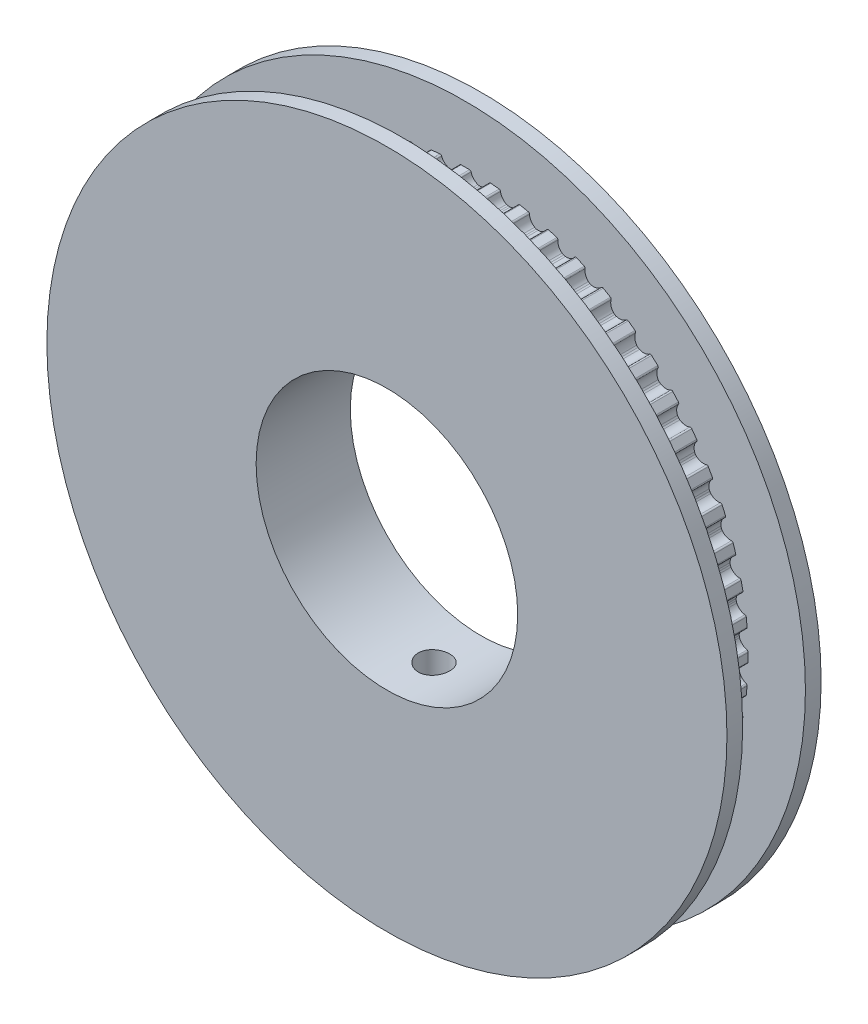
from build123d import *

# Parameters (mm, degrees)
SKETCH2_R           = 27.692960098
BOSS_EXTRUDE1_DEPTH = 3
SKETCH3_R           = 27.692960098
CUT_EXTRUDE5_DEPTH  = 40.620702644
SKETCH4_R           = 32.5
BOSS_EXTRUDE2_DEPTH = 1.5
BOSS_EXTRUDE3_START = 1.5
SKETCH5_R           = 32.5
BOSS_EXTRUDE3_DEPTH = 1.5
CUT_EXTRUDE6_REACH  = 48.835
SKETCH6_R           = 12.5
SKETCH8_R           = 1.5
CUT_EXTRUDE7_DEPTH  = 47.181706335


with BuildPart() as part:
    # Sketch2 → Boss-Extrude1 (new, symmetric)
    with BuildSketch(Plane.XY):
        Circle(SKETCH2_R)
    extrude(amount=BOSS_EXTRUDE1_DEPTH, both=True)

    # Sketch3 → Cut-Extrude5 (cut, through all)
    with BuildSketch(Plane.XY.offset(3)):
        Circle(SKETCH3_R)
        with BuildLine():
            Line((2.427877919, 26.926424266), (3.223495435, 26.842801495))
            ThreePointArc((3.223495435, 26.842801495), (3.312543817, 26.801010915), (3.356554343, 26.713038531))
            ThreePointArc((3.356554343, 26.713038531), (3.543312083, 26.248968735), (3.931469889, 25.933417238))
            ThreePointArc((3.931469889, 25.933417238), (4.013941141, 25.903512456), (4.100094244, 25.886976241))
            ThreePointArc((4.100094244, 25.886976241), (4.187140685, 25.876080343), (4.274816593, 25.879036463))
            ThreePointArc((4.274816593, 25.879036463), (4.741487378, 26.059196411), (5.062509997, 26.442841699))
            ThreePointArc((5.062509997, 26.442841699), (5.131551457, 26.512908409), (5.2291555, 26.525136148))
            Line((5.2291555, 26.525136148), (6.01167358, 26.358806796))
            ThreePointArc((6.01167358, 26.358806796), (6.09586584, 26.307937059), (6.130439654, 26.215846244))
            ThreePointArc((6.130439654, 26.215846244), (6.267665813, 25.734797171), (6.620713136, 25.380400759))
            ThreePointArc((6.620713136, 25.380400759), (6.699606702, 25.342039205), (6.783559343, 25.316588126))
            ThreePointArc((6.783559343, 25.316588126), (6.868990004, 25.296653086), (6.956494612, 25.290428384))
            ThreePointArc((6.956494612, 25.290428384), (7.439440769, 25.420821017), (7.798806645, 25.768808656))
            ThreePointArc((7.798806645, 25.768808656), (7.874793854, 25.831274734), (7.973141358, 25.833233089))
            Line((7.973141358, 25.833233089), (8.733986571, 25.586019493))
            ThreePointArc((8.733986571, 25.586019493), (8.812400282, 25.526627938), (8.837158585, 25.431427659))
            ThreePointArc((8.837158585, 25.431427659), (8.923349684, 24.938669783), (9.237418465, 24.549311298))
            ThreePointArc((9.237418465, 24.549311298), (9.311869969, 24.50291327), (9.392702348, 24.468826174))
            ThreePointArc((9.392702348, 24.468826174), (9.47558123, 24.440070404), (9.561955821, 24.424733079))
            ThreePointArc((9.561955821, 24.424733079), (10.05588609, 24.503929789), (10.449657935, 24.812447152))
            ThreePointArc((10.449657935, 24.812447152), (10.531758361, 24.866628208), (10.629771812, 24.858295721))
            Line((10.629771812, 24.858295721), (11.360608178, 24.532906407))
            ThreePointArc((11.360608178, 24.532906407), (11.432384222, 24.46564374), (11.447055758, 24.36837703))
            ThreePointArc((11.447055758, 24.36837703), (11.48126747, 23.869309111), (11.752916705, 23.449254446))
            ThreePointArc((11.752916705, 23.449254446), (11.822110441, 23.395328289), (11.898936939, 23.352978641))
            ThreePointArc((11.898936939, 23.352978641), (11.978356007, 23.315717197), (12.062654241, 23.291435288))
            ThreePointArc((12.062654241, 23.291435288), (12.562157019, 23.318568378), (12.986020586, 23.584235284))
            ThreePointArc((12.986020586, 23.584235284), (13.07333472, 23.6295377), (13.169940261, 23.611005664))
            Line((13.169940261, 23.611005664), (13.862760584, 23.211005664))
            ThreePointArc((13.862760584, 23.211005664), (13.927112568, 23.13660883), (13.931536592, 23.038341364))
            ThreePointArc((13.931536592, 23.038341364), (13.913394086, 22.538431294), (14.139647529, 22.092282654))
            ThreePointArc((14.139647529, 22.092282654), (14.202825397, 22.031419196), (14.274804288, 21.981270988))
            ThreePointArc((14.274804288, 21.981270988), (14.349893408, 21.935912113), (14.431191697, 21.902951658))
            ThreePointArc((14.431191697, 21.902951658), (14.930794326, 21.877723852), (15.380105678, 22.0976296))
            ThreePointArc((15.380105678, 22.0976296), (15.471676888, 22.133557032), (15.565816088, 22.105028488))
            Line((15.565816088, 22.105028488), (16.213029684, 21.634800286))
            ThreePointArc((16.213029684, 21.634800286), (16.269252554, 21.554084391), (16.263380596, 21.455892809))
            ThreePointArc((16.263380596, 21.455892809), (16.193082645, 20.960617706), (16.371461417, 20.493263191))
            ThreePointArc((16.371461417, 20.493263191), (16.427931225, 20.426129263), (16.494273893, 20.36873193))
            ThreePointArc((16.494273893, 20.36873193), (16.564210374, 20.315772585), (16.641617997, 20.274494706))
            ThreePointArc((16.641617997, 20.274494706), (17.135846727, 20.197182405), (17.605683114, 20.368917661))
            ThreePointArc((17.605683114, 20.368917661), (17.700508127, 20.395076482), (17.791149577, 20.356863994))
            Line((17.791149577, 20.356863994), (18.385665438, 19.821559509))
            ThreePointArc((18.385665438, 19.821559509), (18.433143205, 19.735408894), (18.417039599, 19.638369002))
            ThreePointArc((18.417039599, 19.638369002), (18.295356402, 19.153155205), (18.423906147, 18.669715248))
            ThreePointArc((18.423906147, 18.669715248), (18.473049201, 18.597046384), (18.533028782, 18.533028782))
            ThreePointArc((18.533028782, 18.533028782), (18.597046384, 18.473049201), (18.669715248, 18.423906147))
            ThreePointArc((18.669715248, 18.423906147), (19.153155205, 18.295356402), (19.638369002, 18.417039599))
            ThreePointArc((19.638369002, 18.417039599), (19.735408894, 18.433143205), (19.821559509, 18.385665438))
            Line((19.821559509, 18.385665438), (20.356863994, 17.791149577))
            ThreePointArc((20.356863994, 17.791149577), (20.395076482, 17.700508127), (20.368917661, 17.605683114))
            ThreePointArc((20.368917661, 17.605683114), (20.197182405, 17.135846727), (20.274494706, 16.641617997))
            ThreePointArc((20.274494706, 16.641617997), (20.315772585, 16.564210374), (20.36873193, 16.494273893))
            ThreePointArc((20.36873193, 16.494273893), (20.426129263, 16.427931225), (20.493263191, 16.371461417))
            ThreePointArc((20.493263191, 16.371461417), (20.960617706, 16.193082645), (21.455892809, 16.263380596))
            ThreePointArc((21.455892809, 16.263380596), (21.554084391, 16.269252554), (21.634800286, 16.213029684))
            Line((21.634800286, 16.213029684), (22.105028488, 15.565816088))
            ThreePointArc((22.105028488, 15.565816088), (22.133557032, 15.471676888), (22.0976296, 15.380105678))
            ThreePointArc((22.0976296, 15.380105678), (21.877723852, 14.930794326), (21.902951658, 14.431191697))
            ThreePointArc((21.902951658, 14.431191697), (21.935912113, 14.349893408), (21.981270988, 14.274804288))
            ThreePointArc((21.981270988, 14.274804288), (22.031419196, 14.202825397), (22.092282654, 14.139647529))
            ThreePointArc((22.092282654, 14.139647529), (22.538431294, 13.913394086), (23.038341364, 13.931536592))
            ThreePointArc((23.038341364, 13.931536592), (23.13660883, 13.927112568), (23.211005664, 13.862760584))
            Line((23.211005664, 13.862760584), (23.611005664, 13.169940261))
            ThreePointArc((23.611005664, 13.169940261), (23.6295377, 13.07333472), (23.584235284, 12.986020586))
            ThreePointArc((23.584235284, 12.986020586), (23.318568378, 12.562157019), (23.291435288, 12.062654241))
            ThreePointArc((23.291435288, 12.062654241), (23.315717197, 11.978356007), (23.352978641, 11.898936939))
            ThreePointArc((23.352978641, 11.898936939), (23.395328289, 11.822110441), (23.449254446, 11.752916705))
            ThreePointArc((23.449254446, 11.752916705), (23.869309111, 11.48126747), (24.36837703, 11.447055758))
            ThreePointArc((24.36837703, 11.447055758), (24.46564374, 11.432384222), (24.532906407, 11.360608178))
            Line((24.532906407, 11.360608178), (24.858295721, 10.629771812))
            ThreePointArc((24.858295721, 10.629771812), (24.866628208, 10.531758361), (24.812447152, 10.449657935))
            ThreePointArc((24.812447152, 10.449657935), (24.503929789, 10.05588609), (24.424733079, 9.561955821))
            ThreePointArc((24.424733079, 9.561955821), (24.440070404, 9.47558123), (24.468826174, 9.392702348))
            ThreePointArc((24.468826174, 9.392702348), (24.50291327, 9.311869969), (24.549311298, 9.237418465))
            ThreePointArc((24.549311298, 9.237418465), (24.938669783, 8.923349684), (25.431427659, 8.837158585))
            ThreePointArc((25.431427659, 8.837158585), (25.526627938, 8.812400282), (25.586019493, 8.733986571))
            Line((25.586019493, 8.733986571), (25.833233089, 7.973141358))
            ThreePointArc((25.833233089, 7.973141358), (25.831274734, 7.874793854), (25.768808656, 7.798806645))
            ThreePointArc((25.768808656, 7.798806645), (25.420821017, 7.439440769), (25.290428384, 6.956494612))
            ThreePointArc((25.290428384, 6.956494612), (25.296653086, 6.868990004), (25.316588126, 6.783559343))
            ThreePointArc((25.316588126, 6.783559343), (25.342039205, 6.699606702), (25.380400759, 6.620713136))
            ThreePointArc((25.380400759, 6.620713136), (25.734797171, 6.267665813), (26.215846244, 6.130439654))
            ThreePointArc((26.215846244, 6.130439654), (26.307937059, 6.09586584), (26.358806796, 6.01167358))
            Line((26.358806796, 6.01167358), (26.525136148, 5.2291555))
            ThreePointArc((26.525136148, 5.2291555), (26.512908409, 5.131551457), (26.442841699, 5.062509997))
            ThreePointArc((26.442841699, 5.062509997), (26.059196411, 4.741487378), (25.879036463, 4.274816593))
            ThreePointArc((25.879036463, 4.274816593), (25.876080343, 4.187140685), (25.886976241, 4.100094244))
            ThreePointArc((25.886976241, 4.100094244), (25.903512456, 4.013941141), (25.933417238, 3.931469889))
            ThreePointArc((25.933417238, 3.931469889), (26.248968735, 3.543312083), (26.713038531, 3.356554343))
            ThreePointArc((26.713038531, 3.356554343), (26.801010915, 3.312543817), (26.842801495, 3.223495435))
            Line((26.842801495, 3.223495435), (26.926424266, 2.427877919))
            ThreePointArc((26.926424266, 2.427877919), (26.90406111, 2.332086708), (26.827161436, 2.27074743))
            ThreePointArc((26.827161436, 2.27074743), (26.412061796, 1.991585259), (26.184108402, 1.546302788))
            ThreePointArc((26.184108402, 1.546302788), (26.172003849, 1.459416176), (26.173741227, 1.371707653))
            ThreePointArc((26.173741227, 1.371707653), (26.181181403, 1.284298001), (26.202301771, 1.199152634))
            ThreePointArc((26.202301771, 1.199152634), (26.475551105, 0.780137084), (26.917557178, 0.54589392))
            ThreePointArc((26.917557178, 0.54589392), (27.000447288, 0.49292887), (27.032700844, 0.4))
            Line((27.032700844, 0.4), (27.032700844, -0.4))
            ThreePointArc((27.032700844, -0.4), (27.000447288, -0.49292887), (26.917557178, -0.54589392))
            ThreePointArc((26.917557178, -0.54589392), (26.475551105, -0.780137084), (26.202301771, -1.199152634))
            ThreePointArc((26.202301771, -1.199152634), (26.181181403, -1.284298001), (26.173741227, -1.371707653))
            ThreePointArc((26.173741227, -1.371707653), (26.172003849, -1.459416176), (26.184108402, -1.546302788))
            ThreePointArc((26.184108402, -1.546302788), (26.412061796, -1.991585259), (26.827161436, -2.27074743))
            ThreePointArc((26.827161436, -2.27074743), (26.90406111, -2.332086708), (26.926424266, -2.427877919))
            Line((26.926424266, -2.427877919), (26.842801495, -3.223495435))
            ThreePointArc((26.842801495, -3.223495435), (26.801010915, -3.312543817), (26.713038531, -3.356554343))
            ThreePointArc((26.713038531, -3.356554343), (26.248968735, -3.543312083), (25.933417238, -3.931469889))
            ThreePointArc((25.933417238, -3.931469889), (25.903512456, -4.013941141), (25.886976241, -4.100094244))
            ThreePointArc((25.886976241, -4.100094244), (25.876080343, -4.187140685), (25.879036463, -4.274816593))
            ThreePointArc((25.879036463, -4.274816593), (26.059196411, -4.741487378), (26.442841699, -5.062509997))
            ThreePointArc((26.442841699, -5.062509997), (26.512908409, -5.131551457), (26.525136148, -5.2291555))
            Line((26.525136148, -5.2291555), (26.358806796, -6.01167358))
            ThreePointArc((26.358806796, -6.01167358), (26.307937059, -6.09586584), (26.215846244, -6.130439654))
            ThreePointArc((26.215846244, -6.130439654), (25.734797171, -6.267665813), (25.380400759, -6.620713136))
            ThreePointArc((25.380400759, -6.620713136), (25.342039205, -6.699606702), (25.316588126, -6.783559343))
            ThreePointArc((25.316588126, -6.783559343), (25.296653086, -6.868990004), (25.290428384, -6.956494612))
            ThreePointArc((25.290428384, -6.956494612), (25.420821017, -7.439440769), (25.768808656, -7.798806645))
            ThreePointArc((25.768808656, -7.798806645), (25.831274734, -7.874793854), (25.833233089, -7.973141358))
            Line((25.833233089, -7.973141358), (25.586019493, -8.733986571))
            ThreePointArc((25.586019493, -8.733986571), (25.526627938, -8.812400282), (25.431427659, -8.837158585))
            ThreePointArc((25.431427659, -8.837158585), (24.938669783, -8.923349684), (24.549311298, -9.237418465))
            ThreePointArc((24.549311298, -9.237418465), (24.50291327, -9.311869969), (24.468826174, -9.392702348))
            ThreePointArc((24.468826174, -9.392702348), (24.440070404, -9.47558123), (24.424733079, -9.561955821))
            ThreePointArc((24.424733079, -9.561955821), (24.503929789, -10.05588609), (24.812447152, -10.449657935))
            ThreePointArc((24.812447152, -10.449657935), (24.866628208, -10.531758361), (24.858295721, -10.629771812))
            Line((24.858295721, -10.629771812), (24.532906407, -11.360608178))
            ThreePointArc((24.532906407, -11.360608178), (24.46564374, -11.432384222), (24.36837703, -11.447055758))
            ThreePointArc((24.36837703, -11.447055758), (23.869309111, -11.48126747), (23.449254446, -11.752916705))
            ThreePointArc((23.449254446, -11.752916705), (23.395328289, -11.822110441), (23.352978641, -11.898936939))
            ThreePointArc((23.352978641, -11.898936939), (23.315717197, -11.978356007), (23.291435288, -12.062654241))
            ThreePointArc((23.291435288, -12.062654241), (23.318568378, -12.562157019), (23.584235284, -12.986020586))
            ThreePointArc((23.584235284, -12.986020586), (23.6295377, -13.07333472), (23.611005664, -13.169940261))
            Line((23.611005664, -13.169940261), (23.211005664, -13.862760584))
            ThreePointArc((23.211005664, -13.862760584), (23.13660883, -13.927112568), (23.038341364, -13.931536592))
            ThreePointArc((23.038341364, -13.931536592), (22.538431294, -13.913394086), (22.092282654, -14.139647529))
            ThreePointArc((22.092282654, -14.139647529), (22.031419196, -14.202825397), (21.981270988, -14.274804288))
            ThreePointArc((21.981270988, -14.274804288), (21.935912113, -14.349893408), (21.902951658, -14.431191697))
            ThreePointArc((21.902951658, -14.431191697), (21.877723852, -14.930794326), (22.0976296, -15.380105678))
            ThreePointArc((22.0976296, -15.380105678), (22.133557032, -15.471676888), (22.105028488, -15.565816088))
            Line((22.105028488, -15.565816088), (21.634800286, -16.213029684))
            ThreePointArc((21.634800286, -16.213029684), (21.554084391, -16.269252554), (21.455892809, -16.263380596))
            ThreePointArc((21.455892809, -16.263380596), (20.960617706, -16.193082645), (20.493263191, -16.371461417))
            ThreePointArc((20.493263191, -16.371461417), (20.426129263, -16.427931225), (20.36873193, -16.494273893))
            ThreePointArc((20.36873193, -16.494273893), (20.315772585, -16.564210374), (20.274494706, -16.641617997))
            ThreePointArc((20.274494706, -16.641617997), (20.197182405, -17.135846727), (20.368917661, -17.605683114))
            ThreePointArc((20.368917661, -17.605683114), (20.395076482, -17.700508127), (20.356863994, -17.791149577))
            Line((20.356863994, -17.791149577), (19.821559509, -18.385665438))
            ThreePointArc((19.821559509, -18.385665438), (19.735408894, -18.433143205), (19.638369002, -18.417039599))
            ThreePointArc((19.638369002, -18.417039599), (19.153155205, -18.295356402), (18.669715248, -18.423906147))
            ThreePointArc((18.669715248, -18.423906147), (18.597046384, -18.473049201), (18.533028782, -18.533028782))
            ThreePointArc((18.533028782, -18.533028782), (18.473049201, -18.597046384), (18.423906147, -18.669715248))
            ThreePointArc((18.423906147, -18.669715248), (18.295356402, -19.153155205), (18.417039599, -19.638369002))
            ThreePointArc((18.417039599, -19.638369002), (18.433143205, -19.735408894), (18.385665438, -19.821559509))
            Line((18.385665438, -19.821559509), (17.791149577, -20.356863994))
            ThreePointArc((17.791149577, -20.356863994), (17.700508127, -20.395076482), (17.605683114, -20.368917661))
            ThreePointArc((17.605683114, -20.368917661), (17.135846727, -20.197182405), (16.641617997, -20.274494706))
            ThreePointArc((16.641617997, -20.274494706), (16.564210374, -20.315772585), (16.494273893, -20.36873193))
            ThreePointArc((16.494273893, -20.36873193), (16.427931225, -20.426129263), (16.371461417, -20.493263191))
            ThreePointArc((16.371461417, -20.493263191), (16.193082645, -20.960617706), (16.263380596, -21.455892809))
            ThreePointArc((16.263380596, -21.455892809), (16.269252554, -21.554084391), (16.213029684, -21.634800286))
            Line((16.213029684, -21.634800286), (15.565816088, -22.105028488))
            ThreePointArc((15.565816088, -22.105028488), (15.471676888, -22.133557032), (15.380105678, -22.0976296))
            ThreePointArc((15.380105678, -22.0976296), (14.930794326, -21.877723852), (14.431191697, -21.902951658))
            ThreePointArc((14.431191697, -21.902951658), (14.349893408, -21.935912113), (14.274804288, -21.981270988))
            ThreePointArc((14.274804288, -21.981270988), (14.202825397, -22.031419196), (14.139647529, -22.092282654))
            ThreePointArc((14.139647529, -22.092282654), (13.913394086, -22.538431294), (13.931536592, -23.038341364))
            ThreePointArc((13.931536592, -23.038341364), (13.927112568, -23.13660883), (13.862760584, -23.211005664))
            Line((13.862760584, -23.211005664), (13.169940261, -23.611005664))
            ThreePointArc((13.169940261, -23.611005664), (13.07333472, -23.6295377), (12.986020586, -23.584235284))
            ThreePointArc((12.986020586, -23.584235284), (12.562157019, -23.318568378), (12.062654241, -23.291435288))
            ThreePointArc((12.062654241, -23.291435288), (11.978356007, -23.315717197), (11.898936939, -23.352978641))
            ThreePointArc((11.898936939, -23.352978641), (11.822110441, -23.395328289), (11.752916705, -23.449254446))
            ThreePointArc((11.752916705, -23.449254446), (11.48126747, -23.869309111), (11.447055758, -24.36837703))
            ThreePointArc((11.447055758, -24.36837703), (11.432384222, -24.46564374), (11.360608178, -24.532906407))
            Line((11.360608178, -24.532906407), (10.629771812, -24.858295721))
            ThreePointArc((10.629771812, -24.858295721), (10.531758361, -24.866628208), (10.449657935, -24.812447152))
            ThreePointArc((10.449657935, -24.812447152), (10.05588609, -24.503929789), (9.561955821, -24.424733079))
            ThreePointArc((9.561955821, -24.424733079), (9.47558123, -24.440070404), (9.392702348, -24.468826174))
            ThreePointArc((9.392702348, -24.468826174), (9.311869969, -24.50291327), (9.237418465, -24.549311298))
            ThreePointArc((9.237418465, -24.549311298), (8.923349684, -24.938669783), (8.837158585, -25.431427659))
            ThreePointArc((8.837158585, -25.431427659), (8.812400282, -25.526627938), (8.733986571, -25.586019493))
            Line((8.733986571, -25.586019493), (7.973141358, -25.833233089))
            ThreePointArc((7.973141358, -25.833233089), (7.874793854, -25.831274734), (7.798806645, -25.768808656))
            ThreePointArc((7.798806645, -25.768808656), (7.439440769, -25.420821017), (6.956494612, -25.290428384))
            ThreePointArc((6.956494612, -25.290428384), (6.868990004, -25.296653086), (6.783559343, -25.316588126))
            ThreePointArc((6.783559343, -25.316588126), (6.699606702, -25.342039205), (6.620713136, -25.380400759))
            ThreePointArc((6.620713136, -25.380400759), (6.267665813, -25.734797171), (6.130439654, -26.215846244))
            ThreePointArc((6.130439654, -26.215846244), (6.09586584, -26.307937059), (6.01167358, -26.358806796))
            Line((6.01167358, -26.358806796), (5.2291555, -26.525136148))
            ThreePointArc((5.2291555, -26.525136148), (5.131551457, -26.512908409), (5.062509997, -26.442841699))
            ThreePointArc((5.062509997, -26.442841699), (4.741487378, -26.059196411), (4.274816593, -25.879036463))
            ThreePointArc((4.274816593, -25.879036463), (4.187140685, -25.876080343), (4.100094244, -25.886976241))
            ThreePointArc((4.100094244, -25.886976241), (4.013941141, -25.903512456), (3.931469889, -25.933417238))
            ThreePointArc((3.931469889, -25.933417238), (3.543312083, -26.248968735), (3.356554343, -26.713038531))
            ThreePointArc((3.356554343, -26.713038531), (3.312543817, -26.801010915), (3.223495435, -26.842801495))
            Line((3.223495435, -26.842801495), (2.427877919, -26.926424266))
            ThreePointArc((2.427877919, -26.926424266), (2.332086708, -26.90406111), (2.27074743, -26.827161436))
            ThreePointArc((2.27074743, -26.827161436), (1.991585259, -26.412061796), (1.546302788, -26.184108402))
            ThreePointArc((1.546302788, -26.184108402), (1.459416176, -26.172003849), (1.371707653, -26.173741227))
            ThreePointArc((1.371707653, -26.173741227), (1.284298001, -26.181181403), (1.199152634, -26.202301771))
            ThreePointArc((1.199152634, -26.202301771), (0.780137084, -26.475551105), (0.54589392, -26.917557178))
            ThreePointArc((0.54589392, -26.917557178), (0.49292887, -27.000447288), (0.4, -27.032700844))
            Line((0.4, -27.032700844), (-0.4, -27.032700844))
            ThreePointArc((-0.4, -27.032700844), (-0.49292887, -27.000447288), (-0.54589392, -26.917557178))
            ThreePointArc((-0.54589392, -26.917557178), (-0.780137084, -26.475551105), (-1.199152634, -26.202301771))
            ThreePointArc((-1.199152634, -26.202301771), (-1.284298001, -26.181181403), (-1.371707653, -26.173741227))
            ThreePointArc((-1.371707653, -26.173741227), (-1.459416176, -26.172003849), (-1.546302788, -26.184108402))
            ThreePointArc((-1.546302788, -26.184108402), (-1.991585259, -26.412061796), (-2.27074743, -26.827161436))
            ThreePointArc((-2.27074743, -26.827161436), (-2.332086708, -26.90406111), (-2.427877919, -26.926424266))
            Line((-2.427877919, -26.926424266), (-3.223495435, -26.842801495))
            ThreePointArc((-3.223495435, -26.842801495), (-3.312543817, -26.801010915), (-3.356554343, -26.713038531))
            ThreePointArc((-3.356554343, -26.713038531), (-3.543312083, -26.248968735), (-3.931469889, -25.933417238))
            ThreePointArc((-3.931469889, -25.933417238), (-4.013941141, -25.903512456), (-4.100094244, -25.886976241))
            ThreePointArc((-4.100094244, -25.886976241), (-4.187140685, -25.876080343), (-4.274816593, -25.879036463))
            ThreePointArc((-4.274816593, -25.879036463), (-4.741487378, -26.059196411), (-5.062509997, -26.442841699))
            ThreePointArc((-5.062509997, -26.442841699), (-5.131551457, -26.512908409), (-5.2291555, -26.525136148))
            Line((-5.2291555, -26.525136148), (-6.01167358, -26.358806796))
            ThreePointArc((-6.01167358, -26.358806796), (-6.09586584, -26.307937059), (-6.130439654, -26.215846244))
            ThreePointArc((-6.130439654, -26.215846244), (-6.267665813, -25.734797171), (-6.620713136, -25.380400759))
            ThreePointArc((-6.620713136, -25.380400759), (-6.699606702, -25.342039205), (-6.783559343, -25.316588126))
            ThreePointArc((-6.783559343, -25.316588126), (-6.868990004, -25.296653086), (-6.956494612, -25.290428384))
            ThreePointArc((-6.956494612, -25.290428384), (-7.439440769, -25.420821017), (-7.798806645, -25.768808656))
            ThreePointArc((-7.798806645, -25.768808656), (-7.874793854, -25.831274734), (-7.973141358, -25.833233089))
            Line((-7.973141358, -25.833233089), (-8.733986571, -25.586019493))
            ThreePointArc((-8.733986571, -25.586019493), (-8.812400282, -25.526627938), (-8.837158585, -25.431427659))
            ThreePointArc((-8.837158585, -25.431427659), (-8.923349684, -24.938669783), (-9.237418465, -24.549311298))
            ThreePointArc((-9.237418465, -24.549311298), (-9.311869969, -24.50291327), (-9.392702348, -24.468826174))
            ThreePointArc((-9.392702348, -24.468826174), (-9.47558123, -24.440070404), (-9.561955821, -24.424733079))
            ThreePointArc((-9.561955821, -24.424733079), (-10.05588609, -24.503929789), (-10.449657935, -24.812447152))
            ThreePointArc((-10.449657935, -24.812447152), (-10.531758361, -24.866628208), (-10.629771812, -24.858295721))
            Line((-10.629771812, -24.858295721), (-11.360608178, -24.532906407))
            ThreePointArc((-11.360608178, -24.532906407), (-11.432384222, -24.46564374), (-11.447055758, -24.36837703))
            ThreePointArc((-11.447055758, -24.36837703), (-11.48126747, -23.869309111), (-11.752916705, -23.449254446))
            ThreePointArc((-11.752916705, -23.449254446), (-11.822110441, -23.395328289), (-11.898936939, -23.352978641))
            ThreePointArc((-11.898936939, -23.352978641), (-11.978356007, -23.315717197), (-12.062654241, -23.291435288))
            ThreePointArc((-12.062654241, -23.291435288), (-12.562157019, -23.318568378), (-12.986020586, -23.584235284))
            ThreePointArc((-12.986020586, -23.584235284), (-13.07333472, -23.6295377), (-13.169940261, -23.611005664))
            Line((-13.169940261, -23.611005664), (-13.862760584, -23.211005664))
            ThreePointArc((-13.862760584, -23.211005664), (-13.927112568, -23.13660883), (-13.931536592, -23.038341364))
            ThreePointArc((-13.931536592, -23.038341364), (-13.913394086, -22.538431294), (-14.139647529, -22.092282654))
            ThreePointArc((-14.139647529, -22.092282654), (-14.202825397, -22.031419196), (-14.274804288, -21.981270988))
            ThreePointArc((-14.274804288, -21.981270988), (-14.349893408, -21.935912113), (-14.431191697, -21.902951658))
            ThreePointArc((-14.431191697, -21.902951658), (-14.930794326, -21.877723852), (-15.380105678, -22.0976296))
            ThreePointArc((-15.380105678, -22.0976296), (-15.471676888, -22.133557032), (-15.565816088, -22.105028488))
            Line((-15.565816088, -22.105028488), (-16.213029684, -21.634800286))
            ThreePointArc((-16.213029684, -21.634800286), (-16.269252554, -21.554084391), (-16.263380596, -21.455892809))
            ThreePointArc((-16.263380596, -21.455892809), (-16.193082645, -20.960617706), (-16.371461417, -20.493263191))
            ThreePointArc((-16.371461417, -20.493263191), (-16.427931225, -20.426129263), (-16.494273893, -20.36873193))
            ThreePointArc((-16.494273893, -20.36873193), (-16.564210374, -20.315772585), (-16.641617997, -20.274494706))
            ThreePointArc((-16.641617997, -20.274494706), (-17.135846727, -20.197182405), (-17.605683114, -20.368917661))
            ThreePointArc((-17.605683114, -20.368917661), (-17.700508127, -20.395076482), (-17.791149577, -20.356863994))
            Line((-17.791149577, -20.356863994), (-18.385665438, -19.821559509))
            ThreePointArc((-18.385665438, -19.821559509), (-18.433143205, -19.735408894), (-18.417039598, -19.638369002))
            ThreePointArc((-18.417039598, -19.638369002), (-18.295356402, -19.153155205), (-18.423906147, -18.669715248))
            ThreePointArc((-18.423906147, -18.669715248), (-18.473049201, -18.597046384), (-18.533028782, -18.533028782))
            ThreePointArc((-18.533028782, -18.533028782), (-18.597046384, -18.473049201), (-18.669715248, -18.423906147))
            ThreePointArc((-18.669715248, -18.423906147), (-19.153155205, -18.295356402), (-19.638369002, -18.417039599))
            ThreePointArc((-19.638369002, -18.417039599), (-19.735408894, -18.433143205), (-19.821559509, -18.385665438))
            Line((-19.821559509, -18.385665438), (-20.356863994, -17.791149577))
            ThreePointArc((-20.356863994, -17.791149577), (-20.395076482, -17.700508127), (-20.368917661, -17.605683114))
            ThreePointArc((-20.368917661, -17.605683114), (-20.197182405, -17.135846727), (-20.274494706, -16.641617997))
            ThreePointArc((-20.274494706, -16.641617997), (-20.315772585, -16.564210374), (-20.36873193, -16.494273893))
            ThreePointArc((-20.36873193, -16.494273893), (-20.426129263, -16.427931225), (-20.493263191, -16.371461417))
            ThreePointArc((-20.493263191, -16.371461417), (-20.960617706, -16.193082645), (-21.455892809, -16.263380596))
            ThreePointArc((-21.455892809, -16.263380596), (-21.554084391, -16.269252554), (-21.634800286, -16.213029684))
            Line((-21.634800286, -16.213029684), (-22.105028488, -15.565816088))
            ThreePointArc((-22.105028488, -15.565816088), (-22.133557032, -15.471676888), (-22.0976296, -15.380105678))
            ThreePointArc((-22.0976296, -15.380105678), (-21.877723852, -14.930794326), (-21.902951658, -14.431191697))
            ThreePointArc((-21.902951658, -14.431191697), (-21.935912113, -14.349893408), (-21.981270988, -14.274804288))
            ThreePointArc((-21.981270988, -14.274804288), (-22.031419196, -14.202825397), (-22.092282654, -14.139647529))
            ThreePointArc((-22.092282654, -14.139647529), (-22.538431294, -13.913394086), (-23.038341364, -13.931536592))
            ThreePointArc((-23.038341364, -13.931536592), (-23.13660883, -13.927112568), (-23.211005664, -13.862760584))
            Line((-23.211005664, -13.862760584), (-23.611005664, -13.169940261))
            ThreePointArc((-23.611005664, -13.169940261), (-23.6295377, -13.07333472), (-23.584235284, -12.986020586))
            ThreePointArc((-23.584235284, -12.986020586), (-23.318568378, -12.562157019), (-23.291435288, -12.062654241))
            ThreePointArc((-23.291435288, -12.062654241), (-23.315717197, -11.978356007), (-23.352978641, -11.898936939))
            ThreePointArc((-23.352978641, -11.898936939), (-23.395328289, -11.822110441), (-23.449254446, -11.752916705))
            ThreePointArc((-23.449254446, -11.752916705), (-23.869309111, -11.48126747), (-24.36837703, -11.447055758))
            ThreePointArc((-24.36837703, -11.447055758), (-24.46564374, -11.432384222), (-24.532906407, -11.360608178))
            Line((-24.532906407, -11.360608178), (-24.858295721, -10.629771812))
            ThreePointArc((-24.858295721, -10.629771812), (-24.866628208, -10.531758361), (-24.812447152, -10.449657935))
            ThreePointArc((-24.812447152, -10.449657935), (-24.503929789, -10.05588609), (-24.424733079, -9.561955821))
            ThreePointArc((-24.424733079, -9.561955821), (-24.440070404, -9.47558123), (-24.468826174, -9.392702348))
            ThreePointArc((-24.468826174, -9.392702348), (-24.50291327, -9.311869969), (-24.549311298, -9.237418465))
            ThreePointArc((-24.549311298, -9.237418465), (-24.938669783, -8.923349684), (-25.431427659, -8.837158585))
            ThreePointArc((-25.431427659, -8.837158585), (-25.526627938, -8.812400282), (-25.586019493, -8.733986571))
            Line((-25.586019493, -8.733986571), (-25.833233089, -7.973141358))
            ThreePointArc((-25.833233089, -7.973141358), (-25.831274734, -7.874793854), (-25.768808656, -7.798806645))
            ThreePointArc((-25.768808656, -7.798806645), (-25.420821017, -7.439440769), (-25.290428384, -6.956494612))
            ThreePointArc((-25.290428384, -6.956494612), (-25.296653086, -6.868990004), (-25.316588126, -6.783559343))
            ThreePointArc((-25.316588126, -6.783559343), (-25.342039205, -6.699606702), (-25.380400759, -6.620713136))
            ThreePointArc((-25.380400759, -6.620713136), (-25.734797171, -6.267665813), (-26.215846244, -6.130439654))
            ThreePointArc((-26.215846244, -6.130439654), (-26.307937059, -6.09586584), (-26.358806796, -6.01167358))
            Line((-26.358806796, -6.01167358), (-26.525136148, -5.2291555))
            ThreePointArc((-26.525136148, -5.2291555), (-26.512908409, -5.131551457), (-26.442841699, -5.062509997))
            ThreePointArc((-26.442841699, -5.062509997), (-26.059196411, -4.741487378), (-25.879036463, -4.274816593))
            ThreePointArc((-25.879036463, -4.274816593), (-25.876080343, -4.187140685), (-25.886976241, -4.100094244))
            ThreePointArc((-25.886976241, -4.100094244), (-25.903512456, -4.013941141), (-25.933417238, -3.931469889))
            ThreePointArc((-25.933417238, -3.931469889), (-26.248968735, -3.543312083), (-26.713038531, -3.356554343))
            ThreePointArc((-26.713038531, -3.356554343), (-26.801010915, -3.312543817), (-26.842801495, -3.223495435))
            Line((-26.842801495, -3.223495435), (-26.926424266, -2.427877919))
            ThreePointArc((-26.926424266, -2.427877919), (-26.90406111, -2.332086708), (-26.827161436, -2.27074743))
            ThreePointArc((-26.827161436, -2.27074743), (-26.412061796, -1.991585259), (-26.184108402, -1.546302788))
            ThreePointArc((-26.184108402, -1.546302788), (-26.172003849, -1.459416176), (-26.173741227, -1.371707653))
            ThreePointArc((-26.173741227, -1.371707653), (-26.181181403, -1.284298001), (-26.202301771, -1.199152634))
            ThreePointArc((-26.202301771, -1.199152634), (-26.475551105, -0.780137084), (-26.917557178, -0.54589392))
            ThreePointArc((-26.917557178, -0.54589392), (-27.000447288, -0.49292887), (-27.032700844, -0.4))
            Line((-27.032700844, -0.4), (-27.032700844, 0.4))
            ThreePointArc((-27.032700844, 0.4), (-27.000447288, 0.49292887), (-26.917557178, 0.54589392))
            ThreePointArc((-26.917557178, 0.54589392), (-26.475551105, 0.780137084), (-26.202301771, 1.199152634))
            ThreePointArc((-26.202301771, 1.199152634), (-26.181181403, 1.284298001), (-26.173741227, 1.371707653))
            ThreePointArc((-26.173741227, 1.371707653), (-26.172003849, 1.459416176), (-26.184108402, 1.546302788))
            ThreePointArc((-26.184108402, 1.546302788), (-26.412061796, 1.991585259), (-26.827161436, 2.27074743))
            ThreePointArc((-26.827161436, 2.27074743), (-26.90406111, 2.332086708), (-26.926424266, 2.427877919))
            Line((-26.926424266, 2.427877919), (-26.842801495, 3.223495435))
            ThreePointArc((-26.842801495, 3.223495435), (-26.801010915, 3.312543817), (-26.713038531, 3.356554343))
            ThreePointArc((-26.713038531, 3.356554343), (-26.248968735, 3.543312083), (-25.933417238, 3.931469889))
            ThreePointArc((-25.933417238, 3.931469889), (-25.903512456, 4.013941141), (-25.886976241, 4.100094244))
            ThreePointArc((-25.886976241, 4.100094244), (-25.876080343, 4.187140685), (-25.879036463, 4.274816593))
            ThreePointArc((-25.879036463, 4.274816593), (-26.059196411, 4.741487378), (-26.442841699, 5.062509997))
            ThreePointArc((-26.442841699, 5.062509997), (-26.512908409, 5.131551457), (-26.525136148, 5.2291555))
            Line((-26.525136148, 5.2291555), (-26.358806796, 6.01167358))
            ThreePointArc((-26.358806796, 6.01167358), (-26.307937059, 6.09586584), (-26.215846244, 6.130439654))
            ThreePointArc((-26.215846244, 6.130439654), (-25.734797171, 6.267665813), (-25.380400759, 6.620713136))
            ThreePointArc((-25.380400759, 6.620713136), (-25.342039205, 6.699606702), (-25.316588126, 6.783559343))
            ThreePointArc((-25.316588126, 6.783559343), (-25.296653086, 6.868990004), (-25.290428384, 6.956494612))
            ThreePointArc((-25.290428384, 6.956494612), (-25.420821017, 7.439440769), (-25.768808656, 7.798806645))
            ThreePointArc((-25.768808656, 7.798806645), (-25.831274734, 7.874793854), (-25.833233089, 7.973141358))
            Line((-25.833233089, 7.973141358), (-25.586019493, 8.733986571))
            ThreePointArc((-25.586019493, 8.733986571), (-25.526627938, 8.812400282), (-25.431427659, 8.837158585))
            ThreePointArc((-25.431427659, 8.837158585), (-24.938669783, 8.923349684), (-24.549311298, 9.237418465))
            ThreePointArc((-24.549311298, 9.237418465), (-24.50291327, 9.311869969), (-24.468826174, 9.392702348))
            ThreePointArc((-24.468826174, 9.392702348), (-24.440070404, 9.47558123), (-24.424733079, 9.561955821))
            ThreePointArc((-24.424733079, 9.561955821), (-24.503929789, 10.05588609), (-24.812447152, 10.449657935))
            ThreePointArc((-24.812447152, 10.449657935), (-24.866628208, 10.531758361), (-24.858295721, 10.629771812))
            Line((-24.858295721, 10.629771812), (-24.532906407, 11.360608178))
            ThreePointArc((-24.532906407, 11.360608178), (-24.46564374, 11.432384222), (-24.36837703, 11.447055758))
            ThreePointArc((-24.36837703, 11.447055758), (-23.869309111, 11.48126747), (-23.449254446, 11.752916705))
            ThreePointArc((-23.449254446, 11.752916705), (-23.395328289, 11.822110441), (-23.352978641, 11.898936939))
            ThreePointArc((-23.352978641, 11.898936939), (-23.315717197, 11.978356007), (-23.291435288, 12.062654241))
            ThreePointArc((-23.291435288, 12.062654241), (-23.318568378, 12.562157019), (-23.584235284, 12.986020586))
            ThreePointArc((-23.584235284, 12.986020586), (-23.6295377, 13.07333472), (-23.611005664, 13.169940261))
            Line((-23.611005664, 13.169940261), (-23.211005664, 13.862760584))
            ThreePointArc((-23.211005664, 13.862760584), (-23.13660883, 13.927112568), (-23.038341364, 13.931536592))
            ThreePointArc((-23.038341364, 13.931536592), (-22.538431294, 13.913394086), (-22.092282654, 14.139647529))
            ThreePointArc((-22.092282654, 14.139647529), (-22.031419196, 14.202825397), (-21.981270988, 14.274804288))
            ThreePointArc((-21.981270988, 14.274804288), (-21.935912113, 14.349893408), (-21.902951658, 14.431191697))
            ThreePointArc((-21.902951658, 14.431191697), (-21.877723852, 14.930794326), (-22.0976296, 15.380105678))
            ThreePointArc((-22.0976296, 15.380105678), (-22.133557032, 15.471676888), (-22.105028488, 15.565816088))
            Line((-22.105028488, 15.565816088), (-21.634800286, 16.213029684))
            ThreePointArc((-21.634800286, 16.213029684), (-21.554084391, 16.269252554), (-21.455892809, 16.263380596))
            ThreePointArc((-21.455892809, 16.263380596), (-20.960617706, 16.193082645), (-20.493263191, 16.371461417))
            ThreePointArc((-20.493263191, 16.371461417), (-20.426129263, 16.427931225), (-20.36873193, 16.494273893))
            ThreePointArc((-20.36873193, 16.494273893), (-20.315772585, 16.564210374), (-20.274494706, 16.641617997))
            ThreePointArc((-20.274494706, 16.641617997), (-20.197182405, 17.135846727), (-20.368917661, 17.605683114))
            ThreePointArc((-20.368917661, 17.605683114), (-20.395076482, 17.700508127), (-20.356863994, 17.791149577))
            Line((-20.356863994, 17.791149577), (-19.821559509, 18.385665438))
            ThreePointArc((-19.821559509, 18.385665438), (-19.735408894, 18.433143205), (-19.638369002, 18.417039599))
            ThreePointArc((-19.638369002, 18.417039599), (-19.153155205, 18.295356402), (-18.669715248, 18.423906147))
            ThreePointArc((-18.669715248, 18.423906147), (-18.597046384, 18.473049201), (-18.533028782, 18.533028782))
            ThreePointArc((-18.533028782, 18.533028782), (-18.473049201, 18.597046384), (-18.423906147, 18.669715248))
            ThreePointArc((-18.423906147, 18.669715248), (-18.295356402, 19.153155205), (-18.417039599, 19.638369002))
            ThreePointArc((-18.417039599, 19.638369002), (-18.433143205, 19.735408894), (-18.385665438, 19.821559509))
            Line((-18.385665438, 19.821559509), (-17.791149577, 20.356863994))
            ThreePointArc((-17.791149577, 20.356863994), (-17.700508127, 20.395076482), (-17.605683114, 20.368917661))
            ThreePointArc((-17.605683114, 20.368917661), (-17.135846727, 20.197182405), (-16.641617997, 20.274494706))
            ThreePointArc((-16.641617997, 20.274494706), (-16.564210374, 20.315772585), (-16.494273893, 20.36873193))
            ThreePointArc((-16.494273893, 20.36873193), (-16.427931225, 20.426129263), (-16.371461417, 20.493263191))
            ThreePointArc((-16.371461417, 20.493263191), (-16.193082645, 20.960617706), (-16.263380596, 21.455892809))
            ThreePointArc((-16.263380596, 21.455892809), (-16.269252554, 21.554084391), (-16.213029684, 21.634800286))
            Line((-16.213029684, 21.634800286), (-15.565816088, 22.105028488))
            ThreePointArc((-15.565816088, 22.105028488), (-15.471676888, 22.133557032), (-15.380105678, 22.0976296))
            ThreePointArc((-15.380105678, 22.0976296), (-14.930794326, 21.877723852), (-14.431191697, 21.902951658))
            ThreePointArc((-14.431191697, 21.902951658), (-14.349893408, 21.935912113), (-14.274804288, 21.981270988))
            ThreePointArc((-14.274804288, 21.981270988), (-14.202825397, 22.031419196), (-14.139647529, 22.092282654))
            ThreePointArc((-14.139647529, 22.092282654), (-13.913394086, 22.538431294), (-13.931536592, 23.038341364))
            ThreePointArc((-13.931536592, 23.038341364), (-13.927112568, 23.13660883), (-13.862760584, 23.211005664))
            Line((-13.862760584, 23.211005664), (-13.169940261, 23.611005664))
            ThreePointArc((-13.169940261, 23.611005664), (-13.07333472, 23.6295377), (-12.986020586, 23.584235284))
            ThreePointArc((-12.986020586, 23.584235284), (-12.562157019, 23.318568378), (-12.062654241, 23.291435288))
            ThreePointArc((-12.062654241, 23.291435288), (-11.978356007, 23.315717197), (-11.898936939, 23.352978641))
            ThreePointArc((-11.898936939, 23.352978641), (-11.822110441, 23.395328289), (-11.752916705, 23.449254446))
            ThreePointArc((-11.752916705, 23.449254446), (-11.48126747, 23.869309111), (-11.447055758, 24.36837703))
            ThreePointArc((-11.447055758, 24.36837703), (-11.432384222, 24.46564374), (-11.360608178, 24.532906407))
            Line((-11.360608178, 24.532906407), (-10.629771812, 24.858295721))
            ThreePointArc((-10.629771812, 24.858295721), (-10.531758361, 24.866628208), (-10.449657935, 24.812447152))
            ThreePointArc((-10.449657935, 24.812447152), (-10.05588609, 24.503929789), (-9.561955821, 24.424733079))
            ThreePointArc((-9.561955821, 24.424733079), (-9.47558123, 24.440070404), (-9.392702348, 24.468826174))
            ThreePointArc((-9.392702348, 24.468826174), (-9.311869969, 24.50291327), (-9.237418465, 24.549311298))
            ThreePointArc((-9.237418465, 24.549311298), (-8.923349684, 24.938669783), (-8.837158585, 25.431427659))
            ThreePointArc((-8.837158585, 25.431427659), (-8.812400282, 25.526627938), (-8.733986571, 25.586019493))
            Line((-8.733986571, 25.586019493), (-7.973141358, 25.833233089))
            ThreePointArc((-7.973141358, 25.833233089), (-7.874793854, 25.831274734), (-7.798806645, 25.768808656))
            ThreePointArc((-7.798806645, 25.768808656), (-7.439440769, 25.420821017), (-6.956494612, 25.290428384))
            ThreePointArc((-6.956494612, 25.290428384), (-6.868990004, 25.296653086), (-6.783559343, 25.316588126))
            ThreePointArc((-6.783559343, 25.316588126), (-6.699606702, 25.342039205), (-6.620713136, 25.380400759))
            ThreePointArc((-6.620713136, 25.380400759), (-6.267665813, 25.734797171), (-6.130439654, 26.215846244))
            ThreePointArc((-6.130439654, 26.215846244), (-6.09586584, 26.307937059), (-6.01167358, 26.358806796))
            Line((-6.01167358, 26.358806796), (-5.2291555, 26.525136148))
            ThreePointArc((-5.2291555, 26.525136148), (-5.131551457, 26.512908409), (-5.062509997, 26.442841699))
            ThreePointArc((-5.062509997, 26.442841699), (-4.741487378, 26.059196411), (-4.274816593, 25.879036463))
            ThreePointArc((-4.274816593, 25.879036463), (-4.187140685, 25.876080343), (-4.100094244, 25.886976241))
            ThreePointArc((-4.100094244, 25.886976241), (-4.013941141, 25.903512456), (-3.931469889, 25.933417238))
            ThreePointArc((-3.931469889, 25.933417238), (-3.543312083, 26.248968735), (-3.356554343, 26.713038531))
            ThreePointArc((-3.356554343, 26.713038531), (-3.312543817, 26.801010915), (-3.223495435, 26.842801495))
            Line((-3.223495435, 26.842801495), (-2.427877919, 26.926424266))
            ThreePointArc((-2.427877919, 26.926424266), (-2.332086708, 26.90406111), (-2.27074743, 26.827161436))
            ThreePointArc((-2.27074743, 26.827161436), (-1.991585259, 26.412061796), (-1.546302788, 26.184108402))
            ThreePointArc((-1.546302788, 26.184108402), (-1.459416176, 26.172003849), (-1.371707653, 26.173741227))
            ThreePointArc((-1.371707653, 26.173741227), (-1.284298001, 26.181181403), (-1.199152634, 26.202301771))
            ThreePointArc((-1.199152634, 26.202301771), (-0.780137084, 26.475551105), (-0.54589392, 26.917557178))
            ThreePointArc((-0.54589392, 26.917557178), (-0.49292887, 27.000447288), (-0.4, 27.032700844))
            Line((-0.4, 27.032700844), (0.4, 27.032700844))
            ThreePointArc((0.4, 27.032700844), (0.49292887, 27.000447288), (0.54589392, 26.917557178))
            ThreePointArc((0.54589392, 26.917557178), (0.780137084, 26.475551105), (1.199152634, 26.202301771))
            ThreePointArc((1.199152634, 26.202301771), (1.284298001, 26.181181403), (1.371707653, 26.173741227))
            ThreePointArc((1.371707653, 26.173741227), (1.459416176, 26.172003849), (1.546302788, 26.184108402))
            ThreePointArc((1.546302788, 26.184108402), (1.991585259, 26.412061796), (2.27074743, 26.827161436))
            ThreePointArc((2.27074743, 26.827161436), (2.332086708, 26.90406111), (2.427877919, 26.926424266))
        make_face(mode=Mode.SUBTRACT)
    extrude(amount=-CUT_EXTRUDE5_DEPTH, mode=Mode.SUBTRACT)

    # Sketch4 → Boss-Extrude2 (add)
    with BuildSketch(Plane.XY.offset(3)):
        Circle(SKETCH4_R)
    extrude(amount=BOSS_EXTRUDE2_DEPTH)

    # Sketch5 → Boss-Extrude3 (add)
    with BuildSketch(Plane(origin=(0, 0, -3), x_dir=(-1, 0, 0), z_dir=(0, 0, -1)).offset(BOSS_EXTRUDE3_START)):
        Circle(SKETCH5_R)
    extrude(amount=-BOSS_EXTRUDE3_DEPTH)

    # Sketch6 → Cut-Extrude6 (cut, up to next)
    with BuildSketch(Plane.XY.offset(4.5), mode=Mode.PRIVATE) as cut_extrude6_sk1:
        Circle(SKETCH6_R)
    cut_extrude6_tool1 = extrude(cut_extrude6_sk1.sketch, amount=-CUT_EXTRUDE6_REACH, mode=Mode.PRIVATE) & part.part
    add(cut_extrude6_tool1.solids().sort_by_distance((0, 0, 4.5))[0], mode=Mode.SUBTRACT)

    # Sketch8 → Cut-Extrude7 (cut, through all)
    with BuildSketch(Plane(origin=(0, 0, 0), x_dir=(1, 0, 0), z_dir=(0, 1, 0))):
        Circle(SKETCH8_R)
    extrude(amount=-CUT_EXTRUDE7_DEPTH, mode=Mode.SUBTRACT)


solid = part.part
